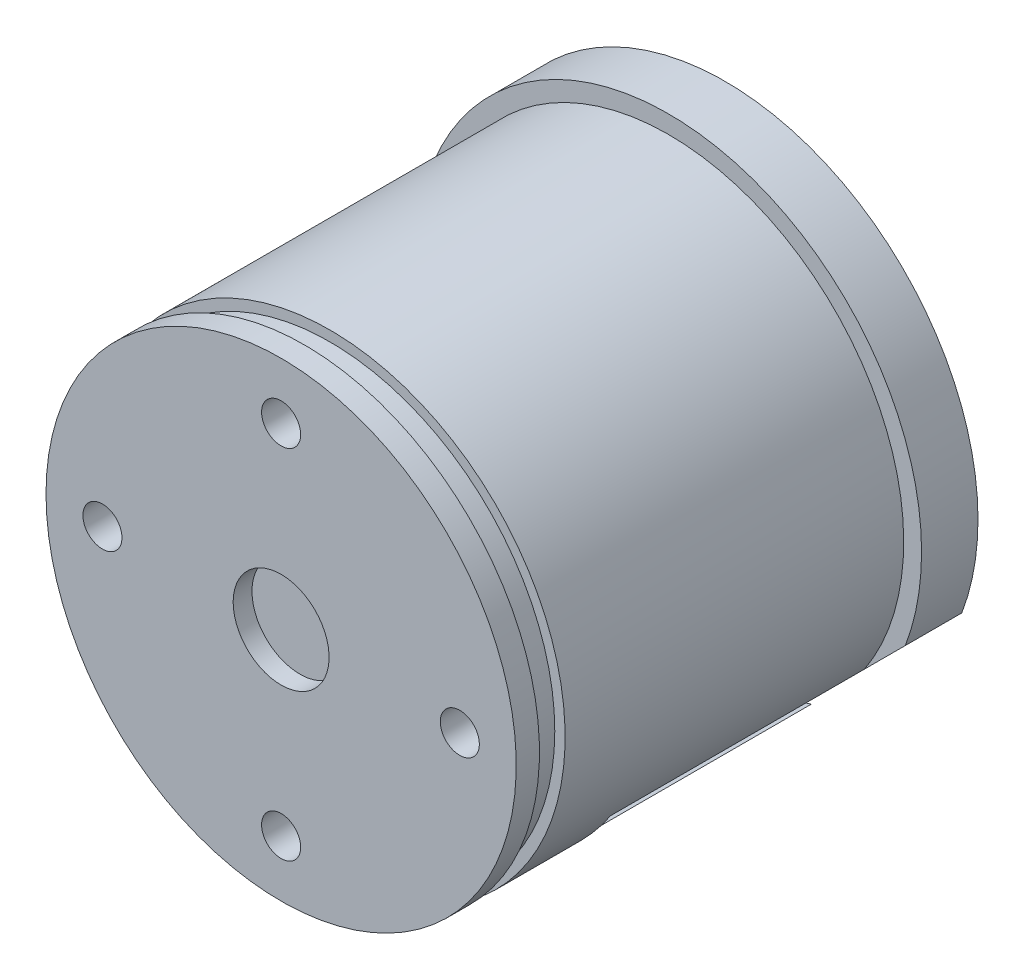
from build123d import *

# Parameters (mm, degrees)
SKETCH11_R              = 1.038643292
CUT_EXTRUDE1_DEPTH      = 29.038634061
CIRPATTERN1_COUNT       = 4
CUT_EXTRUDE2_DEPTH      = 13.5
CUT_EXTRUDE2_DEPTH_BACK = 29.038634061
CUT_EXTRUDE3_DEPTH      = 29.038634061
CUT_EXTRUDE5_DEPTH      = 1


with BuildPart() as part:
    # Sketch10 → Revolve1 (revolve)
    with BuildSketch(Plane(origin=(0, 0, 0), x_dir=(1, 0, 0), z_dir=(0, 1, 0))):
        Polygon((-13.45, 3), (0, 3), (0, -19.6), (-2.55, -19.6), (-2.55, -20.6), (-12.5, -20.6), (-12.5, -19.365), (-11.95, -19.365), (-11.95, -18), (-12.5, -18), (-12.5, 0), (-13.45, 0), align=None)
    revolve(axis=Axis((0, 0, -38.468953364), (0, 0, 1)))

    # Sketch11 → Cut-Extrude1 (cut, symmetric)
    with BuildSketch(Plane.XY):
        with Locations((9.5, 0)):
            Circle(SKETCH11_R)
    cut_extrude1 = extrude(amount=CUT_EXTRUDE1_DEPTH, both=True, mode=Mode.SUBTRACT)

    # CirPattern1: Cut-Extrude1 ×4 about axis
    cirpattern1_axis = Axis((0, 0, 21.78), (0, 0, -1))
    for i in range(1, CIRPATTERN1_COUNT):
        add(cut_extrude1.rotate(cirpattern1_axis, i * 360 / CIRPATTERN1_COUNT), mode=Mode.SUBTRACT)

    # Sketch14 → Cut-Extrude2 (cut, two sides: drawn at the far end of the back side and taken through both)
    with BuildSketch(Plane.XY.offset(-CUT_EXTRUDE2_DEPTH_BACK)):
        with BuildLine():
            Line((2.488712619, -7.568632823), (-0.234923155, -0.085505036))
            Line((-0.234923155, -0.085505036), (-1.431993657, 3.203419137))
            Line((-1.431993657, 3.203419137), (-0.962147346, 3.374429209))
            Line((-0.962147346, 3.374429209), (0.234923155, 0.085505036))
            Line((0.234923155, 0.085505036), (2.958558929, -7.397622752))
            ThreePointArc((2.958558929, -7.397622752), (5.463462014, -9.5943638), (8.66205807, -8.66205807))
            Line((8.66205807, -8.66205807), (17.500892834, 0.176776695))
            Line((17.500892834, 0.176776695), (17.854446225, -0.176776695))
            Line((17.854446225, -0.176776695), (9.01561146, -9.01561146))
            ThreePointArc((9.01561146, -9.01561146), (5.355242207, -10.082511803), (2.488712619, -7.568632823))
        make_face()
    extrude(amount=CUT_EXTRUDE2_DEPTH + CUT_EXTRUDE2_DEPTH_BACK, mode=Mode.SUBTRACT)

    # Sketch15 → Cut-Extrude3 (cut, through all)
    with BuildSketch(Plane.XY):
        Polygon((13.841422119, -3.48269402), (4.052993985, -13.271122155), (6.246974385, -15.465102555), (16.035402519, -5.67667442), align=None)
    extrude(amount=-CUT_EXTRUDE3_DEPTH, mode=Mode.SUBTRACT)

    # Sketch17 → Cut-Extrude5 (cut)
    with BuildSketch(Plane(origin=(0, 0, -3), x_dir=(-1, 0, 0), z_dir=(0, 0, -1))):
        with BuildLine():
            Line((1.431993657, 3.203419137), (0.234923155, -0.085505036))
            Line((0.234923155, -0.085505036), (-0.962147346, -3.374429209))
            Line((-0.962147346, -3.374429209), (-5.66061045, -1.664328492))
            ThreePointArc((-5.66061045, -1.664328492), (-6.224898094, -1.147254133), (-6.258282928, -0.382615728))
            Line((-6.258282928, -0.382615728), (-4.548182211, 4.315847376))
            ThreePointArc((-4.548182211, 4.315847376), (-4.031107852, 4.88013502), (-3.266469447, 4.913519854))
            Line((-3.266469447, 4.913519854), (1.431993657, 3.203419137))
        make_face()
    extrude(amount=-CUT_EXTRUDE5_DEPTH, mode=Mode.SUBTRACT)


solid = part.part
